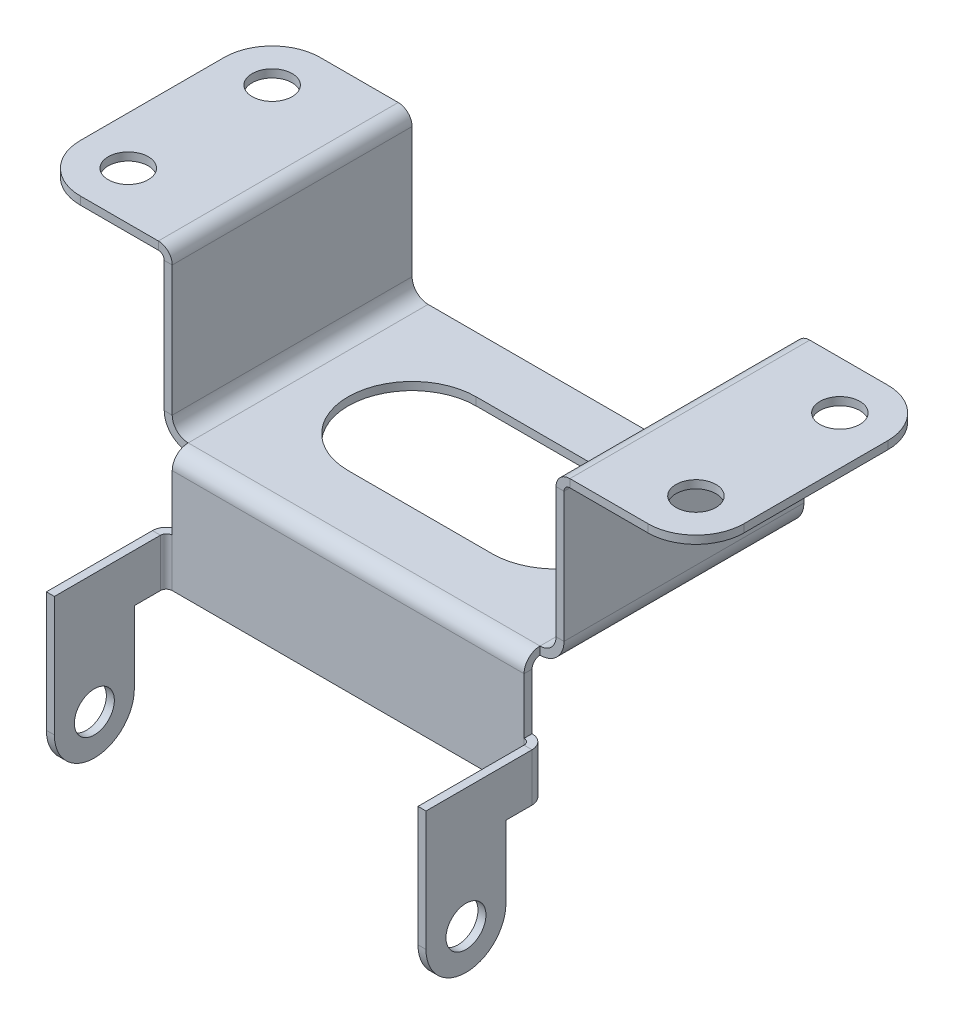
from build123d import *

# Parameters (mm, degrees)
SKETCH1_W                      = 50
SKETCH1_H                      = 30
BASE_FLANGE1_DEPTH             = 1
EDGE_FLANGE1_STRIP_W           = 8
EDGE_FLANGE1_STRIP_H           = 1
EDGE_FLANGE1_STRIP_CUT_DEPTH   = 30
EDGE_FLANGE1_STRIP_2_W         = 8
EDGE_FLANGE1_STRIP_2_H         = 1
EDGE_FLANGE1_STRIP_CUT_2_DEPTH = 30
EDGE_FLANGE1_DEPTH             = 30
EDGE_FLANGE1_BEND_DEPTH        = 30
EDGE_FLANGE2_STRIP_W           = 5.4732
EDGE_FLANGE2_STRIP_H           = 1
EDGE_FLANGE2_STRIP_CUT_DEPTH   = 30
EDGE_FLANGE2_STRIP_2_W         = 5.4732
EDGE_FLANGE2_STRIP_2_H         = 1
EDGE_FLANGE2_STRIP_CUT_2_DEPTH = 30
EDGE_FLANGE2_DEPTH             = 30
EDGE_FLANGE2_BEND_DEPTH        = 30
EDGE_FLANGE3_DEPTH             = 44
EDGE_FLANGE4_DEPTH             = 6
EDGE_FLANGE4_START             = 1
EDGE_FLANGE4_PROFILE_R         = 2.5
EDGE_FLANGE4_FLAT_DEPTH        = 1
CUT_EXTRUDE1_DEPTH             = 60.36539396
CUT_EXTRUDE1_DEPTH_BACK        = 60.36539396
SKETCH38_R                     = 2.5
FILLET1_R                      = 6


# Sheet-metal steps are written as plain solids
with BuildPart() as part:
    # Sketch1 → Base-Flange1 (new body)
    with BuildSketch(Plane(origin=(0, 0, 0), x_dir=(1, 0, 0), z_dir=(0, 1, 0))):
        Rectangle(SKETCH1_W, SKETCH1_H)
    extrude(amount=-BASE_FLANGE1_DEPTH)

    # Edge-Flange1 strip (across the edge) → Edge-Flange1 strip cut (cut)
    with BuildSketch(Plane(origin=(25, 0, 15), x_dir=(-1, 0, 0), z_dir=(0, 0, -1))):
        with Locations((-1, -0.5)):
            Rectangle(EDGE_FLANGE1_STRIP_W, EDGE_FLANGE1_STRIP_H)
    extrude(amount=EDGE_FLANGE1_STRIP_CUT_DEPTH, mode=Mode.SUBTRACT)

    # Edge-Flange1 strip 2 (across the edge) → Edge-Flange1 strip cut 2 (cut)
    with BuildSketch(Plane(origin=(-25, 0, -15), x_dir=(1, 0, 0), z_dir=(0, 0, 1))):
        with Locations((-1, -0.5)):
            Rectangle(EDGE_FLANGE1_STRIP_2_W, EDGE_FLANGE1_STRIP_2_H)
    extrude(amount=EDGE_FLANGE1_STRIP_CUT_2_DEPTH, mode=Mode.SUBTRACT)

    # Edge-Flange1 section (across the edge) → Edge-Flange1 (add)
    with BuildSketch(Plane(origin=(25, 0, 15), x_dir=(-1, 0, 0), z_dir=(0, 0, -1))):
        with BuildLine():
            Line((0, 2), (0, 19))
            Line((0, 19), (1, 19))
            Line((1, 19), (1, 2))
            ThreePointArc((1, 2), (1.585786438, 0.585786438), (3, 0))
            Line((3, 0), (3, -1))
            ThreePointArc((3, -1), (0.878679656, -0.121320344), (0, 2))
        make_face()
    extrude(amount=EDGE_FLANGE1_DEPTH)

    # Edge-Flange1 section 2 (across the edge) → Edge-Flange1 bend (add)
    with BuildSketch(Plane(origin=(-25, 0, -15), x_dir=(1, 0, 0), z_dir=(0, 0, 1))):
        with BuildLine():
            Line((0, 2), (0, 19))
            Line((0, 19), (1, 19))
            Line((1, 19), (1, 2))
            ThreePointArc((1, 2), (1.585786438, 0.585786438), (3, 0))
            Line((3, 0), (3, -1))
            ThreePointArc((3, -1), (0.878679656, -0.121320344), (0, 2))
        make_face()
    extrude(amount=EDGE_FLANGE1_BEND_DEPTH)

    # Edge-Flange2 strip (across the edge) → Edge-Flange2 strip cut (cut)
    with BuildSketch(Plane(origin=(25, 19, -15), x_dir=(0, -1, 0), z_dir=(0, 0, 1))):
        with Locations((-2, -0.5)):
            Rectangle(EDGE_FLANGE2_STRIP_W, EDGE_FLANGE2_STRIP_H)
    extrude(amount=EDGE_FLANGE2_STRIP_CUT_DEPTH, mode=Mode.SUBTRACT)

    # Edge-Flange2 strip 2 (across the edge) → Edge-Flange2 strip cut 2 (cut)
    with BuildSketch(Plane(origin=(-25, 19, 15), x_dir=(0, -1, 0), z_dir=(0, 0, -1))):
        with Locations((-2, -0.5)):
            Rectangle(EDGE_FLANGE2_STRIP_2_W, EDGE_FLANGE2_STRIP_2_H)
    extrude(amount=EDGE_FLANGE2_STRIP_CUT_2_DEPTH, mode=Mode.SUBTRACT)

    # Edge-Flange2 section (across the edge) → Edge-Flange2 (add)
    with BuildSketch(Plane(origin=(25, 19, -15), x_dir=(0, -1, 0), z_dir=(0, 0, 1))):
        with BuildLine():
            Line((-1, 0.7366), (-1, 16.5))
            Line((-1, 16.5), (0, 16.5))
            Line((0, 16.5), (0, 0.7366))
            ThreePointArc((0, 0.7366), (0.215745145, 0.215745145), (0.7366, 0))
            Line((0.7366, 0), (0.7366, -1))
            ThreePointArc((0.7366, -1), (-0.491361636, -0.491361636), (-1, 0.7366))
        make_face()
    extrude(amount=EDGE_FLANGE2_DEPTH)

    # Edge-Flange2 section 2 (across the edge) → Edge-Flange2 bend (add)
    with BuildSketch(Plane(origin=(-25, 19, 15), x_dir=(0, -1, 0), z_dir=(0, 0, -1))):
        with BuildLine():
            Line((-1, 0.7366), (-1, 16.5))
            Line((-1, 16.5), (0, 16.5))
            Line((0, 16.5), (0, 0.7366))
            ThreePointArc((0, 0.7366), (0.215745145, 0.215745145), (0.7366, 0))
            Line((0.7366, 0), (0.7366, -1))
            ThreePointArc((0.7366, -1), (-0.491361636, -0.491361636), (-1, 0.7366))
        make_face()
    extrude(amount=EDGE_FLANGE2_BEND_DEPTH)

    # Edge-Flange3 section (across the edge) → Edge-Flange3 (add)
    with BuildSketch(Plane(origin=(22, -1, 16), x_dir=(0, 0, -1), z_dir=(-1, 0, 0))):
        with BuildLine():
            Line((-1, 1), (-1, 14))
            Line((-1, 14), (0, 14))
            Line((0, 14), (0, 1))
            ThreePointArc((0, 1), (0.292893219, 0.292893219), (1, 0))
            Line((1, 0), (1, -1))
            ThreePointArc((1, -1), (-0.414213562, -0.414213562), (-1, 1))
        make_face()
    extrude(amount=EDGE_FLANGE3_DEPTH)

    # Edge-Flange4 bend section (across the edge) → Edge-Flange4 (add)
    with BuildSketch(Plane(origin=(-22.7366, -9, 17), x_dir=(1, 0, 0), z_dir=(0, -1, 0))):
        with BuildLine():
            Line((-1, 0.7366), (0, 0.7366))
            ThreePointArc((0, 0.7366), (0.215745145, 0.215745145), (0.7366, 0))
            Line((0.7366, 0), (0.7366, -1))
            ThreePointArc((0.7366, -1), (-0.491361636, -0.491361636), (-1, 0.7366))
        make_face()
    edge_flange4 = extrude(amount=EDGE_FLANGE4_DEPTH)

    # Edge-Flange4 profile (on flange) → Edge-Flange4 flat (add)
    with BuildSketch(Plane(origin=(-22.7366, 0, 17), x_dir=(0, -1, 0), z_dir=(-1, 0, 0)).offset(EDGE_FLANGE4_START)):
        with BuildLine():
            Line((9, 14), (9, 0.7366))
            Line((9, 0.7366), (15, 0.7366))
            Line((15, 0.7366), (15, 4))
            Line((15, 4), (24, 4))
            ThreePointArc((24, 4), (29, 9), (24, 14))
            Line((24, 14), (9, 14))
        make_face()
        with Locations((24, 9)):
            Circle(EDGE_FLANGE4_PROFILE_R, mode=Mode.SUBTRACT)
    edge_flange4_flat = extrude(amount=-EDGE_FLANGE4_FLAT_DEPTH)

    # Mirror1: Edge-Flange4, Edge-Flange4 flat across plane
    add(edge_flange4.mirror(Plane(origin=(0, 0, 0), x_dir=(0, 0, 1), z_dir=(1, 0, 0))))
    add(edge_flange4_flat.mirror(Plane(origin=(0, 0, 0), x_dir=(0, 0, 1), z_dir=(1, 0, 0))))

    # Sketch38 → Cut-Extrude1 (cut, two sides: drawn at the far end of the back side and taken through both)
    with BuildSketch(Plane(origin=(0, 0, 0), x_dir=(1, 0, 0), z_dir=(0, 1, 0)).offset(-CUT_EXTRUDE1_DEPTH_BACK)):
        with Locations(Location((-35.5, 9, 0), (0, 0, 270))):
            Circle(SKETCH38_R)
        with Locations(Location((-35.5, -9, 0), (0, 0, 270))):
            Circle(SKETCH38_R)
        with BuildLine():
            Line((-9, -8), (9, -8))
            ThreePointArc((9, -8), (17, 0), (9, 8))
            Line((9, 8), (-9, 8))
            ThreePointArc((-9, 8), (-17, 0), (-9, -8))
        make_face()
        with Locations(Location((35.5, 9, 0), (0, 0, 270))):
            Circle(SKETCH38_R)
        with Locations(Location((35.5, -9, 0), (0, 0, 270))):
            Circle(SKETCH38_R)
    extrude(amount=CUT_EXTRUDE1_DEPTH + CUT_EXTRUDE1_DEPTH_BACK, mode=Mode.SUBTRACT)

    # Fillet1
    fillet1_edges = [part.edges().sort_by_distance(p)[0] for p in [
        (41.5, 19.5, -15),
        (41.5, 19.5, 15),
        (-41.5, 19.5, 15),
        (-41.5, 19.5, -15),
    ]]
    fillet(fillet1_edges, radius=FILLET1_R)


solid = part.part
